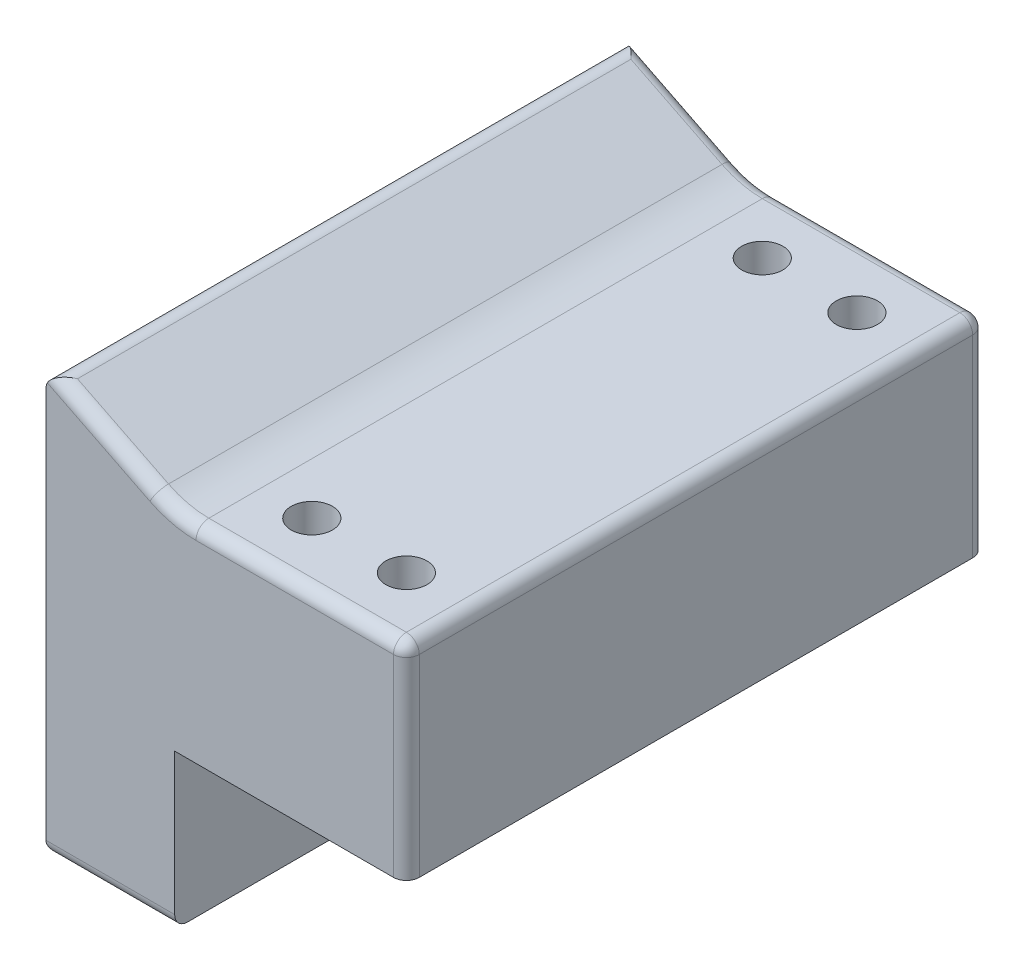
from build123d import *

# Parameters (mm, degrees)
BOSS_EXTRUDE1_DEPTH          = 22.5
CUT_EXTRUDE1_START           = -28
SKETCH12_W                   = 25
SKETCH12_H                   = 9
CUT_EXTRUDE1_DEPTH           = 16
CUT_EXTRUDE2_START           = -28
SKETCH13_R                   = 1.75
CUT_EXTRUDE2_DEPTH           = 10
CUT_EXTRUDE2_DRAFT           = 6
CUT_EXTRUDE2_PROFILE_2_DEPTH = 10
CUT_EXTRUDE2_PROFILE_2_DRAFT = 6
FILLET1_R                    = 7
FILLET2_R                    = 1
SKETCH17_R                   = 1.6
CUT_EXTRUDE5_DEPTH           = 46.543934832


# Read off the part's stored shape, not the designer's step: Cut-Extrude3
with BuildPart() as part:
    # Sketch1 → Boss-Extrude1 (new, symmetric)
    with BuildSketch(Plane.XY):
        Polygon((10, 16), (28, 16), (28, 0), (10, 0), (10, -12), (0, -12), (0, 0), (0, 21), align=None)
    extrude(amount=BOSS_EXTRUDE1_DEPTH, both=True)

    # Sketch12 → Cut-Extrude1 (cut)
    with BuildSketch(Plane(origin=(28, 0, 0), x_dir=(0, 0, -1), z_dir=(1, 0, 0)).offset(CUT_EXTRUDE1_START)):
        with Locations((0, 4.5)):
            Rectangle(SKETCH12_W, SKETCH12_H)
    extrude(amount=CUT_EXTRUDE1_DEPTH, mode=Mode.SUBTRACT)


with BuildPart() as cut_extrude2_tool:
    # Sketch13 → Cut-Extrude2 (with draft: the straight prism first)
    with BuildSketch(Plane(origin=(28, 0, 0), x_dir=(0, 0, -1), z_dir=(1, 0, 0)).offset(CUT_EXTRUDE2_START)):
        with Locations((11.7, 12.996154984)):
            Circle(SKETCH13_R)
    extrude(amount=CUT_EXTRUDE2_DEPTH)
    # Cut-Extrude2: the draft: its side faces are tilted about the plane it starts from
    cut_extrude2_sides = [cut_extrude2_tool.faces().sort_by_distance(p)[0] for p in [
        (5, 12.996154984, -9.95),
    ]]
    draft(cut_extrude2_sides, Plane(origin=(28, 0, 0), x_dir=(0, 0, -1), z_dir=(1, 0, 0)).offset(CUT_EXTRUDE2_START), CUT_EXTRUDE2_DRAFT)


with BuildPart() as part_1:
    add(part.part)

    # Cut-Extrude2: cut by cut_extrude2_tool
    add(cut_extrude2_tool.part, mode=Mode.SUBTRACT)


with BuildPart() as cut_extrude2_profile_2_tool:
    # Sketch13 → Cut-Extrude2 profile 2 (with draft: the straight prism first)
    with BuildSketch(Plane(origin=(28, 0, 0), x_dir=(0, 0, -1), z_dir=(1, 0, 0)).offset(CUT_EXTRUDE2_START)):
        with Locations((-11.7, 12.996154984)):
            Circle(SKETCH13_R)
    extrude(amount=CUT_EXTRUDE2_PROFILE_2_DEPTH)
    # Cut-Extrude2 profile 2: the draft: its side faces are tilted about the plane it starts from
    cut_extrude2_profile_2_sides = [cut_extrude2_profile_2_tool.faces().sort_by_distance(p)[0] for p in [
        (5, 12.996154984, 13.45),
    ]]
    draft(cut_extrude2_profile_2_sides, Plane(origin=(28, 0, 0), x_dir=(0, 0, -1), z_dir=(1, 0, 0)).offset(CUT_EXTRUDE2_START), CUT_EXTRUDE2_PROFILE_2_DRAFT)


with BuildPart() as part_2:
    add(part_1.part)

    # Cut-Extrude2 profile 2: cut by cut_extrude2_profile_2_tool
    add(cut_extrude2_profile_2_tool.part, mode=Mode.SUBTRACT)

    # Cut-Extrude3 outline → Cut-Extrude3 (revolve, cut)
    with BuildSketch(Plane(origin=(0, -4.753845016, 11.7), x_dir=(0, 1, 0), z_dir=(0, 0, -1))):
        Polygon((0, 0), (1.75, 0), (0.522154391, 10), (0, 10), align=None)
    revolve(axis=Axis((0, -4.753845016, 11.7), (1, 0, 0)), mode=Mode.SUBTRACT)

    # Cut-Extrude3 2 outline → Cut-Extrude3 2 (revolve, cut)
    with BuildSketch(Plane(origin=(0, -4.753845016, -11.7), x_dir=(0, 1, 0), z_dir=(0, 0, -1))):
        Polygon((0, 0), (1.75, 0), (0.522154391, 10), (0, 10), align=None)
    revolve(axis=Axis((0, -4.753845016, -11.7), (1, 0, 0)), mode=Mode.SUBTRACT)

    # Fillet1
    fillet1_edges = [part_2.edges().sort_by_distance(p)[0] for p in [
        (10, 16, 0),
    ]]
    fillet(fillet1_edges, radius=FILLET1_R)

    # Fillet2
    fillet2_edges = [part_2.edges().sort_by_distance(p)[0] for p in [
        (5, -12, -22.5),
        (28, 16, 0),
        (0, -12, 0),
        (0, 21, 0),
        (5, -12, 22.5),
        (28, 8, 22.5),
        (19.826237921, 16, 22.5),
        (4.260990337, 18.869504832, -22.5),
        (4.260990337, 18.869504832, 22.5),
        (10.044205399, 16.187257074, -22.5),
        (10.044205399, 16.187257074, 22.5),
        (19.826237921, 16, -22.5),
        (28, 8, -22.5),
    ]]
    fillet(fillet2_edges, radius=FILLET2_R)

    # Sketch17 → Cut-Extrude5 (cut, through all)
    with BuildSketch(Plane(origin=(0, 16, 0), x_dir=(1, 0, 0), z_dir=(0, 1, 0))):
        with Locations(Location((23, 17.5, 0), (0, 0, 270))):
            Circle(SKETCH17_R)
        with Locations(Location((15.652475842, 17.5, 0), (0, 0, 180))):
            Circle(SKETCH17_R)
        with Locations(Location((15.652475842, -17.5, 0), (0, 0, 270))):
            Circle(SKETCH17_R)
        with Locations(Location((23, -17.5, 0), (0, 0, 180))):
            Circle(SKETCH17_R)
    extrude(amount=-CUT_EXTRUDE5_DEPTH, mode=Mode.SUBTRACT)


solid = part_2.part
